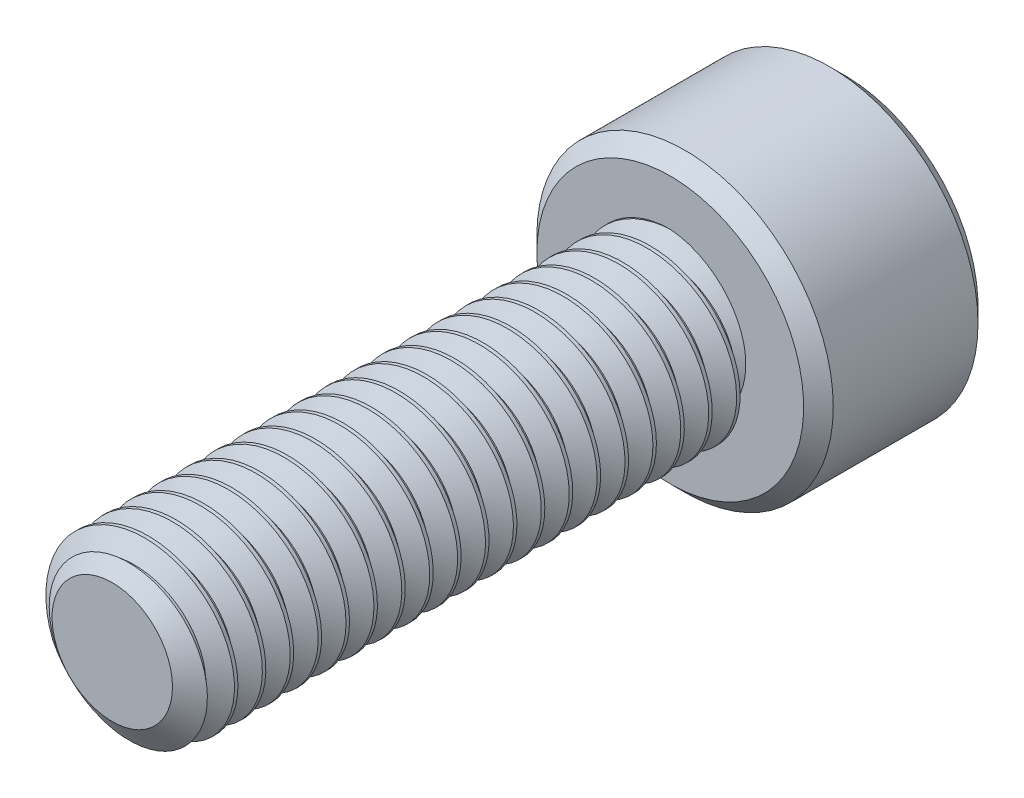
from build123d import *

# Parameters (mm, degrees)
SKETCH1_R          = 2.5
EXTRUDE1_DEPTH     = 16
CUT_SWEEP1_PITCH   = 0.8
SKETCH6_R          = 4.25
EXTRUDE2_DEPTH     = 5
CUT_EXTRUDE1_DEPTH = 3
CHAMFER1_SIZE      = 0.425


with BuildPart() as part:
    # Sketch1 → Extrude1 (new body)
    with BuildSketch(Plane.XY):
        Circle(SKETCH1_R)
    extrude(amount=-EXTRUDE1_DEPTH)

    # Cut-Sweep1: the profile of Sketch3 profile screwed along a right-hand helix of 21 turns, 6 arcs to a turn; built about Z, then put on its axis
    cut_sweep1_z = Axis((0, 0, 0), (0, 0, 1))
    cut_sweep1_corners = [(2.5003, 0, -0.700173205), (1.980384758, 0, -0.4), (1.980384758, 0, -0.3), (2.5003, 0, 0.000173205)]
    with BuildLine(mode=Mode.PRIVATE) as cut_sweep1_profile:
        Line(cut_sweep1_corners[0], cut_sweep1_corners[1])
        Line(cut_sweep1_corners[1], cut_sweep1_corners[2])
        Line(cut_sweep1_corners[2], cut_sweep1_corners[3])
        Line(cut_sweep1_corners[3], cut_sweep1_corners[0])
    cut_sweep1_cap = Face(cut_sweep1_profile.wire())
    cut_sweep1_turn_angles = [0, 30, 60, 90, 120, 150, 180, 210, 240, 270, 300, 330, 360]
    cut_sweep1_turn_weights = [1, 0.8660254037844387, 1, 0.8660254037844387, 1, 0.8660254037844387, 1, 0.8660254037844387, 1, 0.8660254037844387, 1, 0.8660254037844387, 1]
    cut_sweep1_turn_rails = [Edge.make_bspline([Vector(p[0], p[1], 0).rotate(cut_sweep1_z, cut_sweep1_turn_angles[k]) / cut_sweep1_turn_weights[k] + Vector(0, 0, p[2] + CUT_SWEEP1_PITCH * cut_sweep1_turn_angles[k] / 360) for k in range(13)], [0, 0, 0, 1, 1, 2, 2, 3, 3, 4, 4, 5, 5, 6, 6, 6], 2, cut_sweep1_turn_weights) for p in cut_sweep1_corners]
    cut_sweep1_turn_sides = [Face.make_surface_from_curves(cut_sweep1_turn_rails[p[0]], cut_sweep1_turn_rails[p[1]]) for p in [(0, 1), (1, 2), (2, 3), (3, 0)]]
    cut_sweep1 = Plane(origin=(0, 0, 0), x_dir=(0, 1, 0), z_dir=(0, 0, -1)) * Solid(Shell([*[p.moved(Location((0, 0, CUT_SWEEP1_PITCH * i))) for i in range(21) for p in cut_sweep1_turn_sides], cut_sweep1_cap, cut_sweep1_cap.rotate(cut_sweep1_z, 7560).moved(Location((0, 0, CUT_SWEEP1_PITCH * 7560 / 360)))]))
    add(cut_sweep1, mode=Mode.SUBTRACT)

    # Sketch4 → Cut-Revolve1 (revolve, cut)
    with BuildSketch(Plane(origin=(0, 0, 0), x_dir=(0, 0, -1), z_dir=(1, 0, 0)), mode=Mode.PRIVATE) as cut_revolve1_sk:
        Polygon((0.541691224, 2.5), (0, 1.726384758), (0, 2.5), align=None)
    revolve(cut_revolve1_sk.sketch.rotate(Axis((0, 0, 0), (0, 0, -1)), 260.43858876), axis=Axis((0, 0, 0), (0, 0, -1)), mode=Mode.SUBTRACT)

    # Sketch6 → Extrude2 (add)
    with BuildSketch(Plane(origin=(0, 0, -16), x_dir=(-1, 0, 0), z_dir=(0, 0, -1))):
        Circle(SKETCH6_R)
    extrude(amount=EXTRUDE2_DEPTH)

    # Sketch7 → Cut-Extrude1 (cut)
    with BuildSketch(Plane(origin=(0, 0, -21), x_dir=(-1, 0, 0), z_dir=(0, 0, -1))):
        Polygon((0, 2.309401077), (-2, 1.154700538), (-2, -1.154700538), (0, -2.309401077), (2, -1.154700538), (2, 1.154700538), align=None)
    extrude(amount=-CUT_EXTRUDE1_DEPTH, mode=Mode.SUBTRACT)

    # Cut-Extrude2 cone 1 section (through the dimple's axis) → Cut-Extrude2 (revolve, cut)
    with BuildSketch(Plane(origin=(0, 0, -21), x_dir=(0, 1, 0), z_dir=(1, 0, 0))):
        Polygon((0, 0), (2.309401077, 0), (0, 2.309401077), align=None)
    revolve(axis=Axis((0, 0, -21), (0, 0, 1)), mode=Mode.SUBTRACT)

    # Chamfer1
    chamfer1_edges = [part.edges().sort_by_distance(p)[0] for p in [
        (4.25, 0, -16),
        (4.25, 0, -21),
    ]]
    chamfer(chamfer1_edges, length=CHAMFER1_SIZE)


solid = part.part
